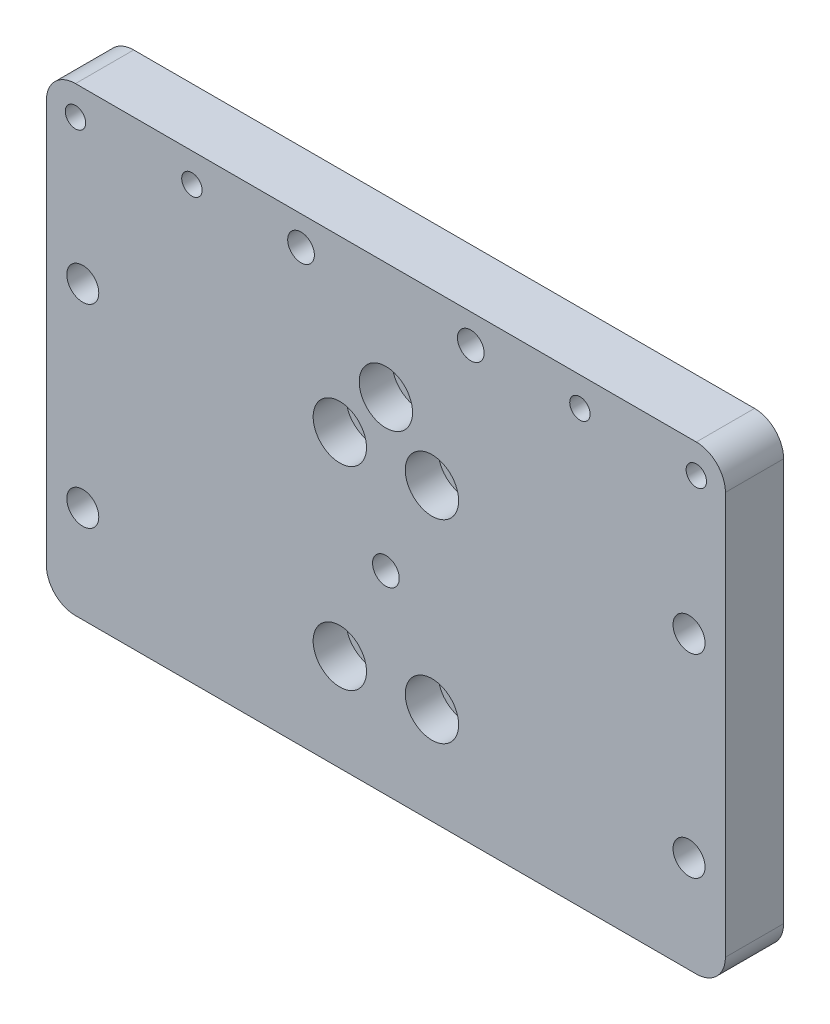
from build123d import *

# Parameters (mm, degrees)
SKETCH1_W           = 140
SKETCH1_H           = 95
BOSS_EXTRUDE1_DEPTH = 6
SKETCH2_R           = 2.75
SKETCH2_R_2         = 3.3
SKETCH2_R_3         = 2.1
CUT_EXTRUDE1_DEPTH  = 86.441500455
SKETCH3_R           = 5.5
CUT_EXTRUDE2_DEPTH  = 6.8
FILLET1_R           = 6


with BuildPart() as part:
    # Sketch1 → Boss-Extrude1 (new, symmetric)
    with BuildSketch(Plane.XY):
        Rectangle(SKETCH1_W, SKETCH1_H)
    extrude(amount=BOSS_EXTRUDE1_DEPTH, both=True)

    # Sketch2 → Cut-Extrude1 (cut, through all)
    with BuildSketch(Plane.XY.offset(6)):
        with Locations((0, 23.5)):
            Circle(SKETCH2_R)
        with Locations((0, -7.5)):
            Circle(SKETCH2_R)
        with Locations((-9.5, 12.5)):
            Circle(SKETCH2_R_2)
        with Locations((-9.5, -27.5)):
            Circle(SKETCH2_R_2)
        with Locations((-17.5, 41.5)):
            Circle(SKETCH2_R)
        with Locations((-40, 41.5)):
            Circle(SKETCH2_R_3)
        with Locations((-64, 41.5)):
            Circle(SKETCH2_R_3)
        with Locations((-62.5, 12.5)):
            Circle(SKETCH2_R_2)
        with Locations((-62.5, -27.5)):
            Circle(SKETCH2_R_2)
        with Locations((62.5, -27.5)):
            Circle(SKETCH2_R_2)
        with Locations((62.5, 12.5)):
            Circle(SKETCH2_R_2)
        with Locations((64, 41.5)):
            Circle(SKETCH2_R_3)
        with Locations((40, 41.5)):
            Circle(SKETCH2_R_3)
        with Locations((17.5, 41.5)):
            Circle(SKETCH2_R)
        with Locations((9.5, -27.5)):
            Circle(SKETCH2_R_2)
        with Locations((9.5, 12.5)):
            Circle(SKETCH2_R_2)
    extrude(amount=-CUT_EXTRUDE1_DEPTH, mode=Mode.SUBTRACT)

    # Sketch3 → Cut-Extrude2 (cut)
    with BuildSketch(Plane.XY.offset(6)):
        with Locations((-9.5, -27.5)):
            Circle(SKETCH3_R)
        with Locations((9.5, -27.5)):
            Circle(SKETCH3_R)
        with Locations((9.5, 12.5)):
            Circle(SKETCH3_R)
        with Locations((0, 23.5)):
            Circle(SKETCH3_R)
        with Locations((-9.5, 12.5)):
            Circle(SKETCH3_R)
    extrude(amount=-CUT_EXTRUDE2_DEPTH, mode=Mode.SUBTRACT)

    # Fillet1
    fillet1_edges = [part.edges().sort_by_distance(p)[0] for p in [
        (70, -47.5, 0),
        (70, 47.5, 0),
        (-70, -47.5, 0),
        (-70, 47.5, 0),
    ]]
    fillet(fillet1_edges, radius=FILLET1_R)


solid = part.part
